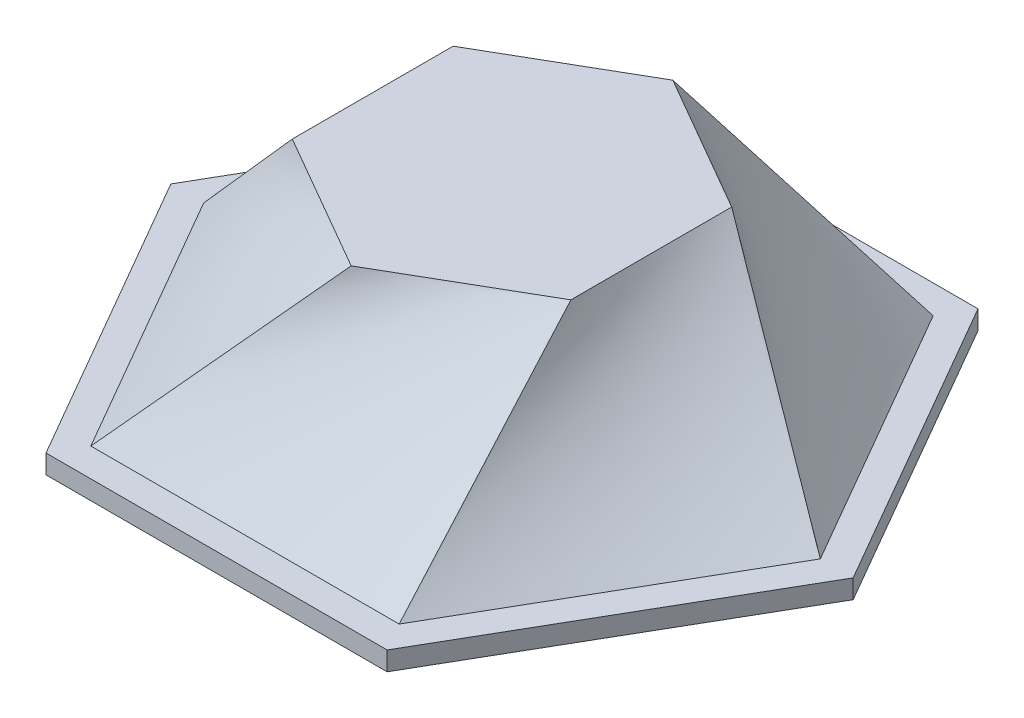
from build123d import *

# Parameters (mm, degrees)
SKETCH3_R           = 3.1
BOSS_EXTRUDE1_DEPTH = 8.5
SKETCH6_R           = 36
CUT_EXTRUDE1_DEPTH  = 20.99999991
BOSS_EXTRUDE2_START = -2
SKETCH5_R           = 3.1
BOSS_EXTRUDE2_DEPTH = 2
SKETCH7_R           = 3.1
BOSS_EXTRUDE3_DEPTH = 2


with BuildPart() as part:
    # Loft1: read off the stored shape, not the designer's step
    # Loft1: loft between two sections, ruled curve by curve
    loft1_from = [
        Edge.make_bspline([(-18, 0, 31.176914536), (-12, 0, 31.176914536), (-6, 0, 31.176914536), (6, 0, 31.176914536), (12, 0, 31.176914536), (18, 0, 31.176914536)], [0, 0, 0, 0, 0.5, 0.5, 1, 1, 1, 1], 3),
        Edge.make_bspline([(18, 0, 31.176914536), (21, 0, 25.980762114), (24, 0, 20.784609691), (30, 0, 10.392304845), (33, 0, 5.196152423), (36, 0, 0)], [0, 0, 0, 0, 0.5, 0.5, 1, 1, 1, 1], 3),
        Edge.make_bspline([(-36, 0, 0), (-33, 0, 5.196152423), (-30, 0, 10.392304845), (-24, 0, 20.784609691), (-21, 0, 25.980762114), (-18, 0, 31.176914536)], [0, 0, 0, 0, 0.5, 0.5, 1, 1, 1, 1], 3),
        Edge.make_bspline([(36, 0, 0), (33, 0, -5.196152423), (30, 0, -10.392304845), (24, 0, -20.784609691), (21, 0, -25.980762114), (18, 0, -31.176914536)], [0, 0, 0, 0, 0.5, 0.5, 1, 1, 1, 1], 3),
        Edge.make_bspline([(18, 0, -31.176914536), (12, 0, -31.176914536), (6, 0, -31.176914536), (-6, 0, -31.176914536), (-12, 0, -31.176914536), (-18, 0, -31.176914536)], [0, 0, 0, 0, 0.5, 0.5, 1, 1, 1, 1], 3),
        Edge.make_bspline([(-18, 0, -31.176914536), (-21, 0, -25.980762114), (-24, 0, -20.784609691), (-30, 0, -10.392304845), (-33, 0, -5.196152423), (-36, 0, 0)], [0, 0, 0, 0, 0.5, 0.5, 1, 1, 1, 1], 3),
    ]
    loft1_to = [
        Edge.make_bspline([(0, 20.99999991, 18.6), (2.684678752, 20.99999991, 17.05), (5.369357503, 20.99999991, 15.5), (10.738715007, 20.99999991, 12.4), (13.423393759, 20.99999991, 10.85), (16.10807251, 20.99999991, 9.3)], [0, 0, 0, 0, 0.5, 0.5, 1, 1, 1, 1], 3),
        Edge.make_bspline([(16.10807251, 20.99999991, 9.3), (16.10807251, 20.99999991, 6.2), (16.10807251, 20.99999991, 3.1), (16.10807251, 20.99999991, -3.1), (16.10807251, 20.99999991, -6.2), (16.10807251, 20.99999991, -9.3)], [0, 0, 0, 0, 0.5, 0.5, 1, 1, 1, 1], 3),
        Edge.make_bspline([(-16.10807251, 20.99999991, 9.3), (-13.423393759, 20.99999991, 10.85), (-10.738715007, 20.99999991, 12.4), (-5.369357503, 20.99999991, 15.5), (-2.684678752, 20.99999991, 17.05), (0, 20.99999991, 18.6)], [0, 0, 0, 0, 0.5, 0.5, 1, 1, 1, 1], 3),
        Edge.make_bspline([(16.10807251, 20.99999991, -9.3), (13.423393759, 20.99999991, -10.85), (10.738715007, 20.99999991, -12.4), (5.369357503, 20.99999991, -15.5), (2.684678752, 20.99999991, -17.05), (0, 20.99999991, -18.6)], [0, 0, 0, 0, 0.5, 0.5, 1, 1, 1, 1], 3),
        Edge.make_bspline([(0, 20.99999991, -18.6), (-2.684678752, 20.99999991, -17.05), (-5.369357503, 20.99999991, -15.5), (-10.738715007, 20.99999991, -12.4), (-13.423393759, 20.99999991, -10.85), (-16.10807251, 20.99999991, -9.3)], [0, 0, 0, 0, 0.5, 0.5, 1, 1, 1, 1], 3),
        Edge.make_bspline([(-16.10807251, 20.99999991, -9.3), (-16.10807251, 20.99999991, -6.2), (-16.10807251, 20.99999991, -3.1), (-16.10807251, 20.99999991, 3.1), (-16.10807251, 20.99999991, 6.2), (-16.10807251, 20.99999991, 9.3)], [0, 0, 0, 0, 0.5, 0.5, 1, 1, 1, 1], 3),
    ]
    loft1 = Solid(Shell([*[Face.make_surface_from_curves(loft1_from[k], loft1_to[k]) for k in range(6)], Face(Wire(loft1_from)), Face(Wire(loft1_to))]))
    add(loft1)

    # Sketch3 → Boss-Extrude1 (add)
    with BuildSketch(Plane.XZ):
        Polygon((4.445597073, 11.622085464), (2.222798536, 15.472085464), (-2.222798536, 15.472085464), (-4.445597073, 11.622085464), (-2.222798536, 7.772085464), (2.222798536, 7.772085464), align=None)
        with Locations(Location((0, 11.622085464, 0), (0, 0, 270))):
            Circle(SKETCH3_R, mode=Mode.SUBTRACT)
    extrude(amount=BOSS_EXTRUDE1_DEPTH)

    # Sketch6 → Cut-Extrude1 (cut)
    with BuildSketch(Plane(origin=(0, 20.99999991, 0), x_dir=(1, 0, 0), z_dir=(0, 1, 0))):
        Circle(SKETCH6_R)
    extrude(amount=-CUT_EXTRUDE1_DEPTH, mode=Mode.SUBTRACT)

    # Sketch5 → Boss-Extrude2 (add)
    with BuildSketch(Plane.XZ.offset(8.5).offset(BOSS_EXTRUDE2_START)):
        Polygon((-8.509, 11.622085464), (-7.369010161, 9.647565142), (-7.369010161, 7.367585464), (-5.394489839, 6.227595625), (-4.2545, 4.253075303), (-1.974520322, 4.253075303), (0, 3.113085464), (1.974520322, 4.253075303), (4.2545, 4.253075303), (5.394489839, 6.227595625), (7.369010161, 7.367585464), (7.369010161, 9.647565142), (8.509, 11.622085464), (7.369010161, 13.596605785), (7.369010161, 15.876585464), (5.394489839, 17.016575303), (4.2545, 18.991095625), (1.974520322, 18.991095625), (0, 20.131085464), (-1.974520322, 18.991095625), (-4.2545, 18.991095625), (-5.394489839, 17.016575303), (-7.369010161, 15.876585464), (-7.369010161, 13.596605785), align=None)
        with Locations(Location((0, 11.622085464, 0), (0, 0, 270))):
            Circle(SKETCH5_R, mode=Mode.SUBTRACT)
    extrude(amount=BOSS_EXTRUDE2_DEPTH)


with BuildPart() as body_2:
    # Sketch7 → Boss-Extrude3 (new body)
    # profile 1 of 4: a face of its own
    with BuildSketch(Plane(origin=(0, 0, 0), x_dir=(1, 0, 0), z_dir=(0, 1, 0))):
        Polygon((18, 31.176914536), (-18, 31.176914536), (-36, 0), (-18, -31.176914536), (18, -31.176914536), (36, 0), align=None)
        Polygon((4.445597073, -11.622085464), (2.222798536, -7.772085464), (-2.222798536, -7.772085464), (-4.445597073, -11.622085464), (-2.222798536, -15.472085464), (2.222798536, -15.472085464), align=None, mode=Mode.SUBTRACT)
    # profile 2 of 4: a face of its own
    with BuildSketch(Plane(origin=(0, 0, 0), x_dir=(1, 0, 0), z_dir=(0, 1, 0))):
        Polygon((2.222798536, -15.472085464), (4.445597073, -11.622085464), (2.222798536, -7.772085464), (-2.222798536, -7.772085464), (-4.445597073, -11.622085464), (-2.222798536, -15.472085464), align=None)
        with Locations(Location((0, -11.622085464, 0), (0, 0, 90))):
            Circle(SKETCH7_R, mode=Mode.SUBTRACT)
    # profile 3 of 4: a face of its own
    with BuildSketch(Plane(origin=(0, 0, 0), x_dir=(1, 0, 0), z_dir=(0, 1, 0))):
        with Locations(Location((0, -11.622085464, 0), (0, 0, 90))):
            Circle(SKETCH7_R)
    # profile 4 of 4: a face of its own
    with BuildSketch(Plane(origin=(0, 0, 0), x_dir=(1, 0, 0), z_dir=(0, 1, 0))):
        Polygon((4.445597073, -11.622085464), (2.222798536, -7.772085464), (-2.222798536, -7.772085464), (-4.445597073, -11.622085464), (-2.222798536, -15.472085464), (2.222798536, -15.472085464), align=None)
    extrude(amount=BOSS_EXTRUDE3_DEPTH)

    # Loft2: read off the stored shape, not the designer's step
    # Loft2: loft between two sections, ruled curve by curve
    loft2_from = [
        Edge.make_bspline([(-32.535898385, 2, 0), (-29.824573519, 2, 4.696152423), (-27.113248654, 2, 9.392304845), (-21.690598923, 2, 18.784609691), (-18.979274058, 2, 23.480762114), (-16.267949192, 2, 28.176914536)], [0, 0, 0, 0, 0.5, 0.5, 1, 1, 1, 1], 3),
        Edge.make_bspline([(-16.267949192, 2, 28.176914536), (-10.845299462, 2, 28.176914536), (-5.422649731, 2, 28.176914536), (5.422649731, 2, 28.176914536), (10.845299462, 2, 28.176914536), (16.267949192, 2, 28.176914536)], [0, 0, 0, 0, 0.5, 0.5, 1, 1, 1, 1], 3),
        Edge.make_bspline([(-16.267949192, 2, -28.176914536), (-18.979274058, 2, -23.480762114), (-21.690598923, 2, -18.784609691), (-27.113248654, 2, -9.392304845), (-29.824573519, 2, -4.696152423), (-32.535898385, 2, 0)], [0, 0, 0, 0, 0.5, 0.5, 1, 1, 1, 1], 3),
        Edge.make_bspline([(16.267949192, 2, 28.176914536), (18.979274058, 2, 23.480762114), (21.690598923, 2, 18.784609691), (27.113248654, 2, 9.392304845), (29.824573519, 2, 4.696152423), (32.535898385, 2, 0)], [0, 0, 0, 0, 0.5, 0.5, 1, 1, 1, 1], 3),
        Edge.make_bspline([(32.535898385, 2, 0), (29.824573519, 2, -4.696152423), (27.113248654, 2, -9.392304845), (21.690598923, 2, -18.784609691), (18.979274058, 2, -23.480762114), (16.267949192, 2, -28.176914536)], [0, 0, 0, 0, 0.5, 0.5, 1, 1, 1, 1], 3),
        Edge.make_bspline([(16.267949192, 2, -28.176914536), (10.845299462, 2, -28.176914536), (5.422649731, 2, -28.176914536), (-5.422649731, 2, -28.176914536), (-10.845299462, 2, -28.176914536), (-16.267949192, 2, -28.176914536)], [0, 0, 0, 0, 0.5, 0.5, 1, 1, 1, 1], 3),
    ]
    loft2_to = [
        Edge.make_bspline([(-14.697928126, 21.0000001, 8.48585276), (-12.248273438, 21.0000001, 9.900161554), (-9.798618751, 21.0000001, 11.314470347), (-4.899309375, 21.0000001, 14.143087934), (-2.449654688, 21.0000001, 15.557396727), (0, 21.0000001, 16.97170552)], [0, 0, 0, 0, 0.5, 0.5, 1, 1, 1, 1], 3),
        Edge.make_bspline([(0, 21.0000001, 16.97170552), (2.449654688, 21.0000001, 15.557396727), (4.899309375, 21.0000001, 14.143087934), (9.798618751, 21.0000001, 11.314470347), (12.248273438, 21.0000001, 9.900161554), (14.697928126, 21.0000001, 8.48585276)], [0, 0, 0, 0, 0.5, 0.5, 1, 1, 1, 1], 3),
        Edge.make_bspline([(-14.697928126, 21.0000001, -8.48585276), (-14.697928126, 21.0000001, -5.657235173), (-14.697928126, 21.0000001, -2.828617587), (-14.697928126, 21.0000001, 2.828617587), (-14.697928126, 21.0000001, 5.657235173), (-14.697928126, 21.0000001, 8.48585276)], [0, 0, 0, 0, 0.5, 0.5, 1, 1, 1, 1], 3),
        Edge.make_bspline([(14.697928126, 21.0000001, 8.48585276), (14.697928126, 21.0000001, 5.657235173), (14.697928126, 21.0000001, 2.828617587), (14.697928126, 21.0000001, -2.828617587), (14.697928126, 21.0000001, -5.657235173), (14.697928126, 21.0000001, -8.48585276)], [0, 0, 0, 0, 0.5, 0.5, 1, 1, 1, 1], 3),
        Edge.make_bspline([(14.697928126, 21.0000001, -8.48585276), (12.248273438, 21.0000001, -9.900161554), (9.798618751, 21.0000001, -11.314470347), (4.899309375, 21.0000001, -14.143087934), (2.449654688, 21.0000001, -15.557396727), (0, 21.0000001, -16.97170552)], [0, 0, 0, 0, 0.5, 0.5, 1, 1, 1, 1], 3),
        Edge.make_bspline([(0, 21.0000001, -16.97170552), (-2.449654688, 21.0000001, -15.557396727), (-4.899309375, 21.0000001, -14.143087934), (-9.798618751, 21.0000001, -11.314470347), (-12.248273438, 21.0000001, -9.900161554), (-14.697928126, 21.0000001, -8.48585276)], [0, 0, 0, 0, 0.5, 0.5, 1, 1, 1, 1], 3),
    ]
    loft2 = Solid(Shell([*[Face.make_surface_from_curves(loft2_from[k], loft2_to[k]) for k in range(6)], Face(Wire(loft2_from)), Face(Wire(loft2_to))]))
    add(loft2)


solid = Compound([part.part, body_2.part])
